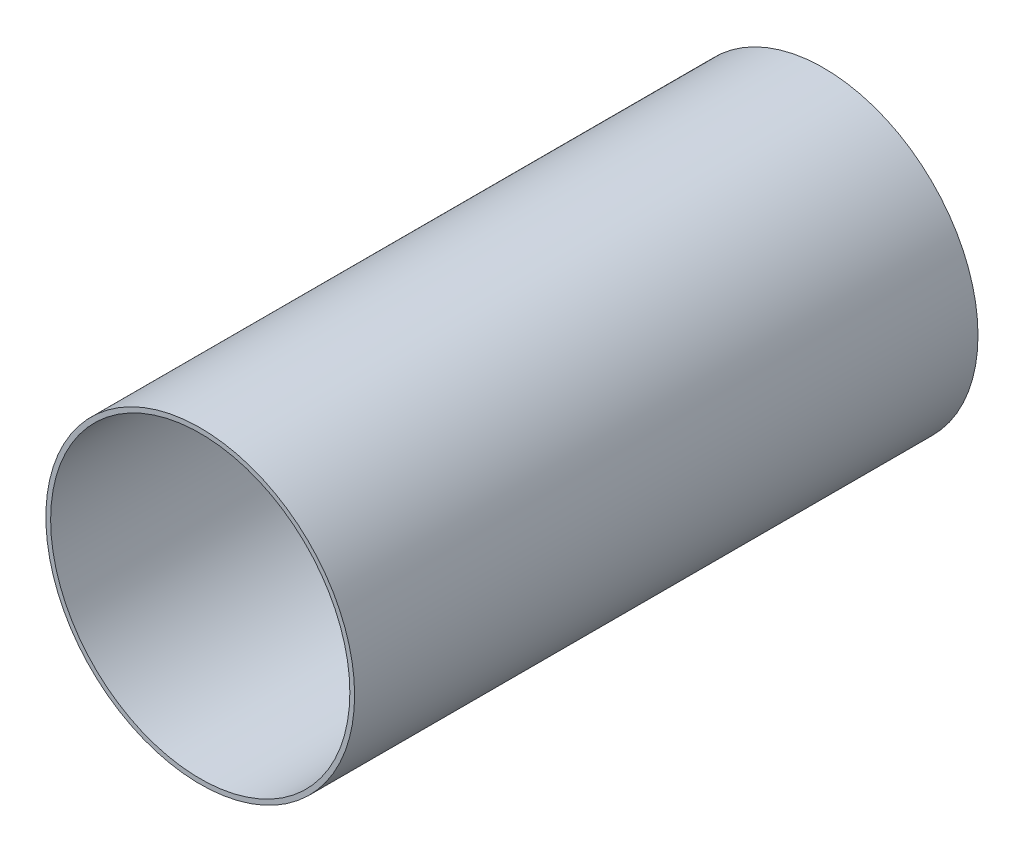
from build123d import *

# Parameters (mm, degrees)
SKETCH1_R           = 49.53
SKETCH1_R_2         = 48
BOSS_EXTRUDE1_DEPTH = 200


with BuildPart() as part:
    # Sketch1 → Boss-Extrude1 (new body)
    with BuildSketch(Plane(origin=(0, 0, 0), x_dir=(0, 1, 0), z_dir=(0, 0, 1))):
        Circle(SKETCH1_R)
        Circle(SKETCH1_R_2, mode=Mode.SUBTRACT)
    extrude(amount=BOSS_EXTRUDE1_DEPTH)


solid = part.part
